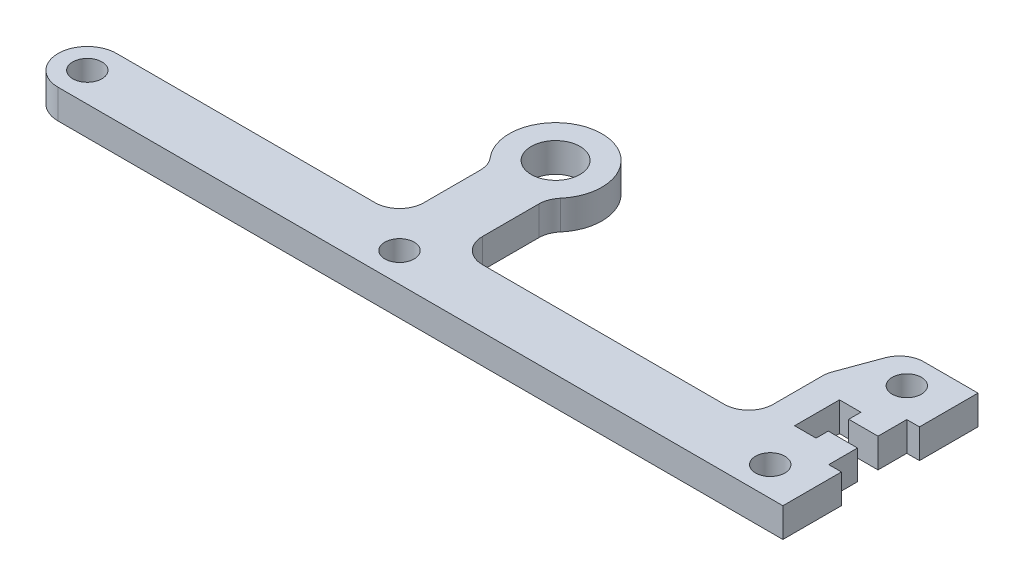
from build123d import *

# Parameters (mm, degrees)
SKETCH1_R           = 1.5
SKETCH1_R_2         = 2.5
BOSS_EXTRUDE1_DEPTH = 3
FILLET1_R           = 2.5


with BuildPart() as part:
    # Sketch1 → Boss-Extrude1 (new body)
    with BuildSketch(Plane(origin=(0, 0, 0), x_dir=(1, 0, 0), z_dir=(0, 1, 0))):
        with BuildLine():
            Line((-3, -13), (-32, -13))
            ThreePointArc((-32, -13), (-35, -16), (-32, -19))
            Line((-32, -19), (42.3, -19))
            Line((42.3, -19), (42.3, -13))
            Line((42.3, -13), (41, -13))
            Line((41, -13), (41, -10.05))
            Line((41, -10.05), (38, -10.05))
            Line((38, -10.05), (38, -11.3))
            Line((38, -11.3), (35.8, -11.3))
            Line((35.8, -11.3), (35.8, -6.7))
            Line((35.8, -6.7), (38, -6.7))
            Line((38, -6.7), (38, -7.95))
            Line((38, -7.95), (41, -7.95))
            Line((41, -7.95), (41, -5))
            Line((41, -5), (42.3, -5))
            Line((42.3, -5), (42.3, 1))
            Line((42.3, 1), (35, 1))
            Line((35, 1), (32.8, -5))
            Line((32.8, -5), (32.8, -13))
            Line((32.8, -13), (3, -13))
            Line((3, -13), (3, -3.682729966))
            ThreePointArc((3, -3.682729966), (0, 4.75), (-3, -3.682729966))
            Line((-3, -3.682729966), (-3, -13))
        make_face()
        with Locations((0, -16)):
            Circle(SKETCH1_R, mode=Mode.SUBTRACT)
        with Locations((-32, -16)):
            Circle(SKETCH1_R, mode=Mode.SUBTRACT)
        Circle(SKETCH1_R_2, mode=Mode.SUBTRACT)
        with Locations((38, -16)):
            Circle(SKETCH1_R, mode=Mode.SUBTRACT)
        with Locations((38, -2)):
            Circle(SKETCH1_R, mode=Mode.SUBTRACT)
    extrude(amount=BOSS_EXTRUDE1_DEPTH)

    # Fillet1
    fillet1_edges = [part.edges().sort_by_distance(p)[0] for p in [
        (35, 1.5, -1),
        (32.8, 1.5, 5),
        (32.8, 1.5, 13),
        (3, 1.5, 13),
        (-3, 1.5, 13),
        (-3, 1.5, 3.682729966),
        (3, 1.5, 3.682729966),
    ]]
    fillet(fillet1_edges, radius=FILLET1_R)


solid = part.part
